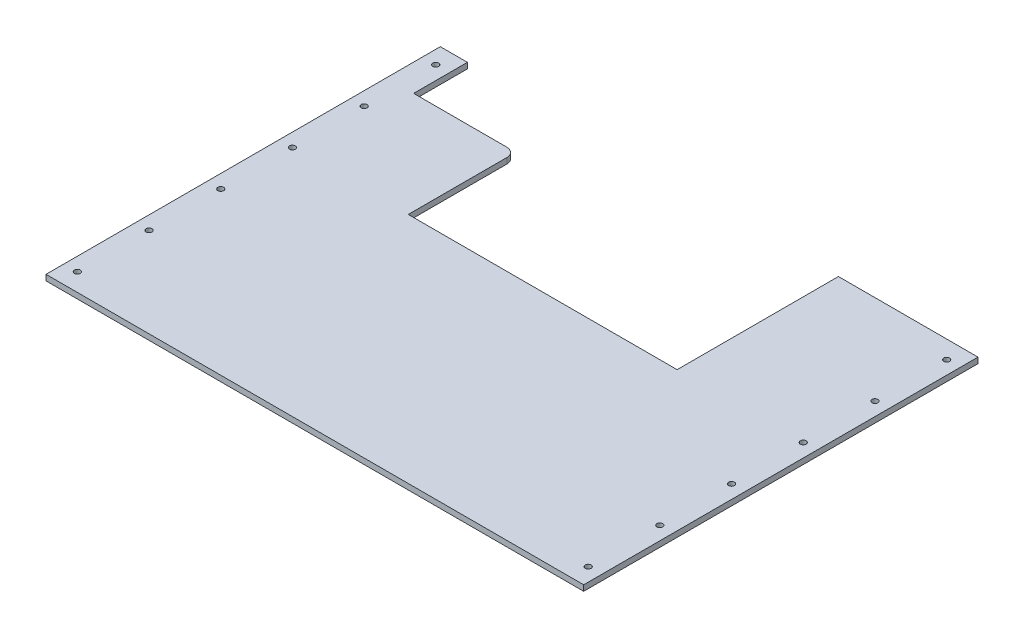
from build123d import *

# Parameters (mm, degrees)
BOSS_EXTRUDE1_DEPTH = 3.18
SKETCH2_R           = 1.65
CUT_EXTRUDE1_DEPTH  = 10
FILLET1_R           = 5


with BuildPart() as part:
    # Sketch1 → Boss-Extrude1 (new body)
    with BuildSketch(Plane(origin=(0, 0, 0), x_dir=(1, 0, 0), z_dir=(0, 1, 0))):
        Polygon((72.127496387, 91.855323554), (72.127496387, 1.855323554), (-77.872503613, 1.855323554), (-77.872503613, 61.855323554), (-134.872503613, 61.855323554), (-134.872503613, 91.855323554), (-150, 91.855323554), (-150, -128.144676446), (150, -128.144676446), (150, 91.855323554), align=None)
    extrude(amount=BOSS_EXTRUDE1_DEPTH)

    # Sketch2 → Cut-Extrude1 (cut)
    with BuildSketch(Plane(origin=(0, 3.18, 0), x_dir=(1, 0, 0), z_dir=(0, 1, 0))):
        with Locations((-142.5, 81.855323554)):
            Circle(SKETCH2_R)
        with Locations((-142.5, 41.855323554)):
            Circle(SKETCH2_R)
        with Locations((-142.5, 1.855323554)):
            Circle(SKETCH2_R)
        with Locations((-142.5, -38.144676446)):
            Circle(SKETCH2_R)
        with Locations((-142.5, -78.144676446)):
            Circle(SKETCH2_R)
        with Locations((-142.5, -118.144676446)):
            Circle(SKETCH2_R)
        with Locations((142.5, 81.855323554)):
            Circle(SKETCH2_R)
        with Locations((142.5, 41.855323554)):
            Circle(SKETCH2_R)
        with Locations((142.5, 1.855323554)):
            Circle(SKETCH2_R)
        with Locations((142.5, -38.144676446)):
            Circle(SKETCH2_R)
        with Locations((142.5, -78.144676446)):
            Circle(SKETCH2_R)
        with Locations((142.5, -118.144676446)):
            Circle(SKETCH2_R)
    extrude(amount=-CUT_EXTRUDE1_DEPTH, mode=Mode.SUBTRACT)

    # Fillet1
    fillet1_edges = [part.edges().sort_by_distance(p)[0] for p in [
        (-77.872503613, 1.59, -61.855323554),
    ]]
    fillet(fillet1_edges, radius=FILLET1_R)


solid = part.part
